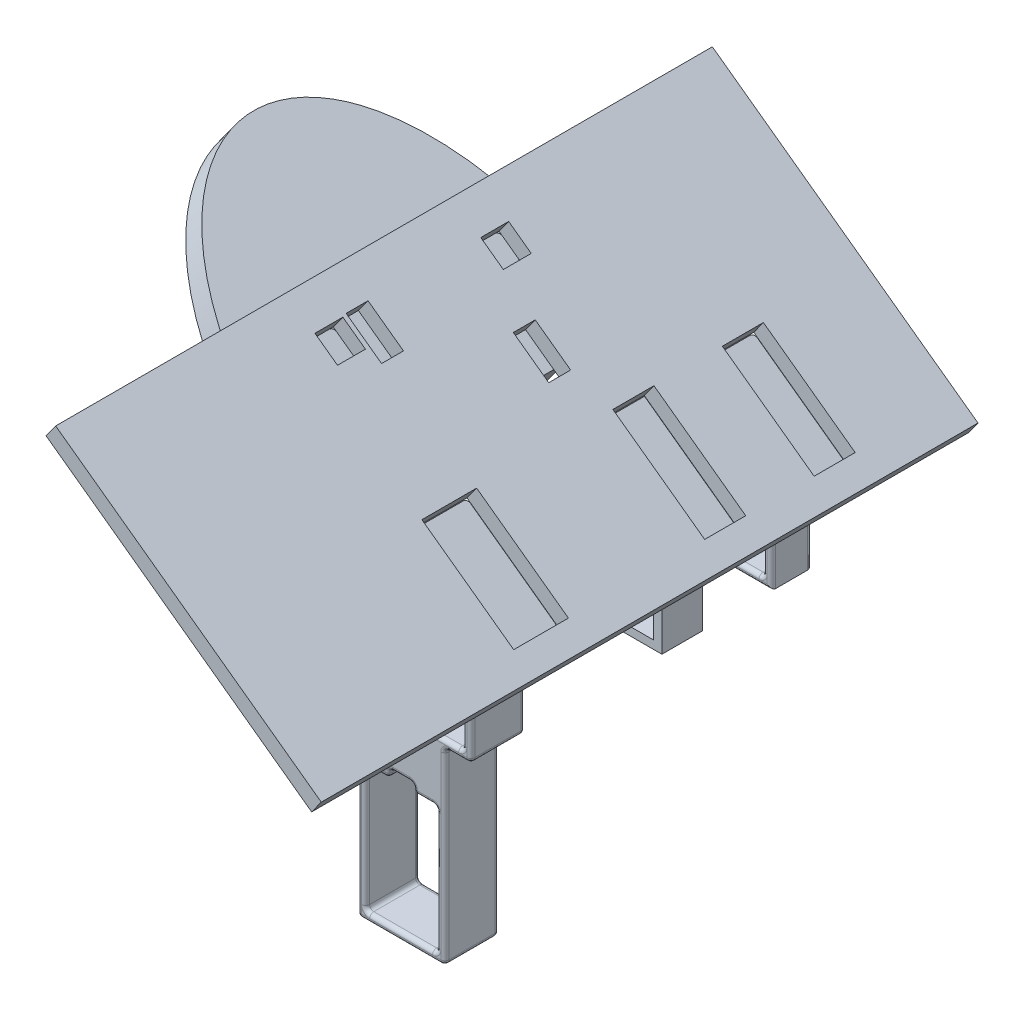
from build123d import *

# Parameters (mm, degrees)
SKETCH3_W                = 22.5
SKETCH3_H                = 8.3
BOSS_EXTRUDE1_DEPTH      = 9.9
SKETCH4_W                = 60
SKETCH4_H                = 120
BOSS_EXTRUDE2_DEPTH      = 3
BOSS_EXTRUDE3_DEPTH      = 4.5
BOSS_EXTRUDE3_DEPTH_BACK = 3
SKETCH7_W                = 5.1
SKETCH7_H                = 5.1
BOSS_EXTRUDE4_DEPTH      = 5
SKETCH9_W                = 22.5
SKETCH9_H                = 8.3
BOSS_EXTRUDE5_DEPTH      = 7.4
SKETCH10_W               = 22.5
SKETCH10_H               = 8.3
BOSS_EXTRUDE6_DEPTH      = 7.4
SKETCH7_2_W              = 5.1
SKETCH7_2_H              = 5.1
CUT_EXTRUDE4_DEPTH       = 10
SKETCH6_W                = 8
SKETCH6_H                = 4
CUT_EXTRUDE1_DEPTH       = 3
FILLET1_R                = 0.75
FILLET4_R                = 0.75
CHAMFER1_SIZE            = 2
FILLET6_R                = 0.75
SKETCH11_W               = 20.73
SKETCH11_H               = 10
SKETCH11_H_2             = 7.5
CUT_EXTRUDE5_DEPTH       = 10


with BuildPart() as part:
    # Sketch3 → Boss-Extrude1 (new body)
    with BuildSketch(Plane.XY):
        Polygon((12.75, -5.65), (12.75, 5.65), (18.857088771, 14.055686572), (2.167122093, 26.181657154), (-12.75, 5.65), (-12.75, -5.65), (-8, -5.65), (-8, -13.95), (-8, -40.05), (8, -40.05), (8, -13.95), (8, -5.65), align=None)
        Rectangle(SKETCH3_W, SKETCH3_H, mode=Mode.SUBTRACT)
        Polygon((-6.5, -15.45), (-6.5, -38.55), (6.5, -38.55), (6.5, -15.45), (2.25, -15.45), (2.25, -13.95), (-2.25, -13.95), (-2.25, -15.45), align=None, mode=Mode.SUBTRACT)
    extrude(amount=BOSS_EXTRUDE1_DEPTH)

    # Sketch4 → Boss-Extrude2 (add)
    with BuildSketch(Plane(origin=(13.198840091, 18.166644872, 0), x_dir=(0.8090169943749486, -0.5877852522924718, 0), z_dir=(0.5877852522924718, 0.8090169943749486, 0))):
        with Locations((-18.320986675, 11.1)):
            Rectangle(SKETCH4_W, SKETCH4_H)
    extrude(amount=BOSS_EXTRUDE2_DEPTH)

    # Sketch7 → Boss-Extrude3 (add, two sides: drawn at the far end of the back side and taken through both)
    with BuildSketch(Plane(origin=(13.198840091, 18.166644872, 0), x_dir=(0.8090169943749486, -0.5877852522924717, 0), z_dir=(-0.5877852522924717, -0.8090169943749486, 0)).offset(-BOSS_EXTRUDE3_DEPTH_BACK)):
        with Locations((-39.306899423, 4.2)):
            Rectangle(SKETCH7_W, SKETCH7_H)
        with Locations((-39.306899675, -26.1)):
            Rectangle(SKETCH7_W, SKETCH7_H)
    extrude(amount=BOSS_EXTRUDE3_DEPTH + BOSS_EXTRUDE3_DEPTH_BACK)

    # Sketch8 → Boss-Extrude4 (add)
    with BuildSketch(Plane(origin=(10.553806455, 14.526068397, 0), x_dir=(0.8090169943749483, -0.587785252292472, 0), z_dir=(-0.587785252292472, -0.8090169943749483, 0))):
        with BuildLine():
            Line((-23.306899423, 5.850397894), (-23.306899423, -28.050397894))
            Line((-23.306899423, -28.050397894), (-34.620607922, -39.364106393))
            add(Edge.make_bspline(
                [(-34.620607922, 17.164106393), (-72.277843991, 11.859740449), (-72.277843991, -11.1), (-72.277843991, -34.059740449), (-34.620607922, -39.364106393)],
                knots=[4.945524145, 4.945524145, 4.945524145, 6.283185307, 6.283185307, 7.620846469, 7.620846469, 7.620846469], degree=2, weights=[1, 0.784547323, 1, 0.784547323, 1]))
            Line((-34.620607922, 17.164106393), (-23.306899423, 5.850397894))
        make_face()
    extrude(amount=BOSS_EXTRUDE4_DEPTH)

    # Sketch9 → Boss-Extrude5 (add)
    with BuildSketch(Plane(origin=(0, 0, -25), x_dir=(-1, 0, 0), z_dir=(0, 0, -1))):
        Polygon((-20.620444528, 16.482737555), (-12.75, 5.65), (-12.75, -5.65), (8, -5.65), (12.75, -5.65), (12.75, 5.65), (-3.93047785, 28.608708137), align=None)
        Rectangle(SKETCH9_W, SKETCH9_H, mode=Mode.SUBTRACT)
    extrude(amount=BOSS_EXTRUDE5_DEPTH)

    # Sketch10 → Boss-Extrude6 (add)
    with BuildSketch(Plane(origin=(0, 0, -45), x_dir=(-1, 0, 0), z_dir=(0, 0, -1))):
        Polygon((-20.620444528, 16.482737555), (-12.75, 5.65), (-12.75, -5.65), (12.75, -5.65), (12.75, 5.65), (-3.93047785, 28.608708137), align=None)
        Rectangle(SKETCH10_W, SKETCH10_H, mode=Mode.SUBTRACT)
    extrude(amount=BOSS_EXTRUDE6_DEPTH)

    # Sketch7<2> → Cut-Extrude4 (cut)
    with BuildSketch(Plane(origin=(13.198840091, 18.166644872, 0), x_dir=(0.8090169943749486, -0.5877852522924717, 0), z_dir=(-0.5877852522924717, -0.8090169943749486, 0))):
        with Locations((-39.306899423, 4.2)):
            Rectangle(SKETCH7_2_W, SKETCH7_2_H)
        with Locations((-39.306899675, -26.1)):
            Rectangle(SKETCH7_2_W, SKETCH7_2_H)
    extrude(amount=-CUT_EXTRUDE4_DEPTH, mode=Mode.SUBTRACT)


with BuildPart() as cut_extrude4_piece_1:
    # of the separate pieces the step leaves, piece 1, a body of its own (cut_extrude4_pieces)
    add(part.part.solids().sort_by_distance((-25.893659315, 46.569008216, -71.1))[0])

    # Sketch6 → Cut-Extrude1 (cut)
    with BuildSketch(Plane(origin=(13.198840091, 18.166644872, 0), x_dir=(0.8090169943749486, -0.5877852522924717, 0), z_dir=(-0.5877852522924717, -0.8090169943749486, 0))):
        with Locations((-24.970986675, -21.075)):
            Rectangle(SKETCH6_W, SKETCH6_H)
        with Locations((-38.070986675, -1.125)):
            Rectangle(SKETCH6_W, SKETCH6_H)
    extrude(amount=-CUT_EXTRUDE1_DEPTH, mode=Mode.SUBTRACT)

    # Fillet1
    fillet1_edges = [cut_extrude4_piece_1.edges().sort_by_distance(p)[0] for p in [
        (8, -22.85, 0),
        (0, -40.05, 0),
        (12.75, 0, 9.9),
        (-8, -22.85, 0),
        (-10.375, -5.65, 0),
        (-12.75, 0, 0),
        (-5.291438953, 15.915828577, 0),
        (15.803544386, 9.852843286, 0),
        (12.75, 0, 0),
        (10.375, -5.65, 0),
        (15.803544386, 9.852843286, 9.9),
        (8, -40.05, 4.95),
        (-8, -40.05, 4.95),
        (-8, -5.65, 4.95),
        (-12.75, -5.65, 4.95),
        (-12.75, 5.65, 4.95),
        (12.75, 5.65, 4.95),
        (12.75, -5.65, 4.95),
        (8, -5.65, 4.95),
        (-5.291438953, 15.915828577, 9.9),
        (-12.75, 0, 9.9),
        (-10.375, -5.65, 9.9),
        (11.25, 0, 0),
        (11.25, -4.15, 4.95),
        (0, 4.15, 0),
        (11.25, 4.15, 4.95),
        (-11.25, 0, 0),
        (-11.25, 4.15, 4.95),
        (0, -4.15, 0),
        (-11.25, -4.15, 4.95),
        (11.25, 0, 9.9),
        (0, 4.15, 9.9),
        (-11.25, 0, 9.9),
        (-8, -22.85, 9.9),
        (0, -4.15, 9.9),
        (0, -40.05, 9.9),
        (8, -22.85, 9.9),
        (6.5, -27, 0),
        (6.5, -38.55, 4.95),
        (4.375, -15.45, 0),
        (6.5, -15.45, 4.95),
        (2.25, -14.7, 0),
        (2.25, -15.45, 4.95),
        (0, -13.95, 0),
        (2.25, -13.95, 4.95),
        (-2.25, -14.7, 0),
        (-2.25, -13.95, 4.95),
        (-4.375, -15.45, 0),
        (-2.25, -15.45, 4.95),
        (-6.5, -27, 0),
        (-6.5, -15.45, 4.95),
        (0, -38.55, 0),
        (-6.5, -38.55, 4.95),
        (6.5, -27, 9.9),
        (4.375, -15.45, 9.9),
        (2.25, -14.7, 9.9),
        (0, -13.95, 9.9),
        (-2.25, -14.7, 9.9),
        (-4.375, -15.45, 9.9),
        (-6.5, -27, 9.9),
        (0, -38.55, 9.9),
        (10.375, -5.65, 9.9),
    ]]
    fillet(fillet1_edges, radius=FILLET1_R - 0.0001)  # a hair under: the kernel refuses the full size

    # Fillet4
    fillet4_edges = [cut_extrude4_piece_1.edges().sort_by_distance(p)[0] for p in [
        (-5.291438953, 15.915828577, -52.4),
        (15.803544386, 9.852843286, -52.4),
        (12.75, 0, -52.4),
        (0, -5.65, -52.4),
        (-12.75, 0, -52.4),
        (0, 4.15, -45),
        (11.25, 0, -45),
        (0, -4.15, -45),
        (-11.25, 0, -45),
        (15.803544386, 9.852843286, -45),
        (-5.291438953, 15.915828577, -45),
        (-12.75, 5.65, -48.7),
        (12.75, 0, -45),
        (12.75, 5.65, -48.7),
        (0, -5.65, -45),
        (-12.75, 0, -45),
        (-12.75, -5.65, -48.7),
        (11.25, 0, -52.4),
        (11.25, -4.15, -48.7),
        (0, -4.15, -52.4),
        (-11.25, -4.15, -48.7),
        (-11.25, 0, -52.4),
        (-11.25, 4.15, -48.7),
        (0, 4.15, -52.4),
        (11.25, 4.15, -48.7),
    ]]
    fillet(fillet4_edges, radius=FILLET4_R - 0.0001)  # a hair under: the kernel refuses the full size

    # Sketch11 → Cut-Extrude5 (cut)
    with BuildSketch(Plane(origin=(13.198840091, 18.166644872, 0), x_dir=(0.8090169943749483, -0.5877852522924719, 0), z_dir=(-0.5877852522924719, -0.8090169943749485, 0))):
        with Locations((-3.375986675, 4.95)):
            Rectangle(SKETCH11_W, SKETCH11_H)
        with Locations((-3.375986675, -28.7)):
            Rectangle(SKETCH11_W, SKETCH11_H_2)
        with Locations((-3.375986675, -48.7)):
            Rectangle(SKETCH11_W, SKETCH11_H_2)
    extrude(amount=-CUT_EXTRUDE5_DEPTH, mode=Mode.SUBTRACT)


with BuildPart() as cut_extrude4_piece_2:
    # of the separate pieces the step leaves, piece 2, a body of its own (cut_extrude4_pieces)
    add(part.part.solids().sort_by_distance((-8.301871264, 28.225520155, 5.850397894))[0])

    # Chamfer1
    chamfer1_edges = [cut_extrude4_piece_2.edges().sort_by_distance(p)[0] for p in [
        (-23.30913651, 39.128936585, 4.2),
        (-21.246143174, 37.630084191, 1.65),
        (-19.183149838, 36.131231798, 4.2),
        (-21.246143174, 37.630084191, 6.75),
        (-21.246143378, 37.63008434, -23.55),
        (-23.309136714, 39.128936733, -26.1),
        (-21.246143378, 37.63008434, -28.65),
        (-19.183150043, 36.131231947, -26.1),
    ]]
    chamfer(chamfer1_edges, length=CHAMFER1_SIZE)

    # Fillet6
    fillet6_edges = [cut_extrude4_piece_2.edges().sort_by_distance(p)[0] for p in [
        (-21.39883444, 41.758241817, 6.75),
        (-17.272847768, 38.76053703, 6.75),
        (-17.272847768, 38.76053703, 1.65),
        (-21.398834644, 41.758241965, -23.55),
        (-17.272847973, 38.760537178, -23.55),
        (-17.272847973, 38.760537178, -28.65),
        (-21.398834644, 41.758241965, -28.65),
        (-21.39883444, 41.758241817, 1.65),
    ]]
    fillet(fillet6_edges, radius=FILLET6_R)


solid = Compound([cut_extrude4_piece_1.part, cut_extrude4_piece_2.part])
